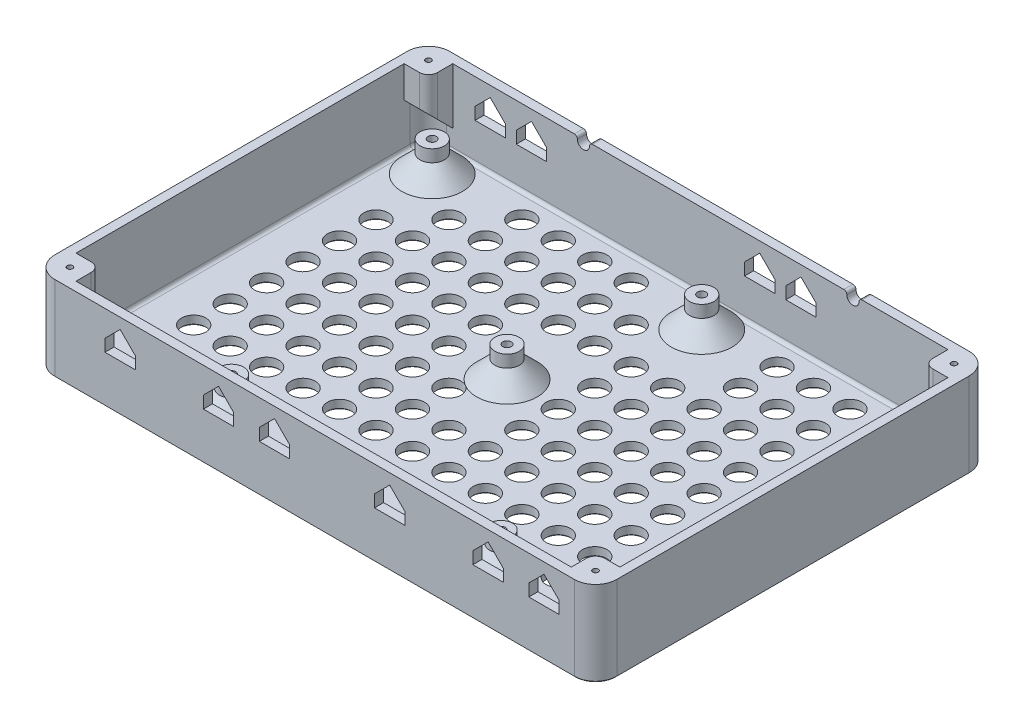
from build123d import *

# Parameters (mm, degrees)
SKETCH_1_W          = 185
SKETCH_1_H          = 130
EXTRUDE_1_DEPTH     = 3
SKETCH_2_R          = 4
SKETCH_2_R_2        = 3.743503122
EXTRUDE_2_DEPTH     = 10
CHAMFER_1_SIZE      = 6
SKETCH_3_R          = 1.4
CUT_EXTRUDE_1_DEPTH = 227.481787347
SKETCH_4_W          = 185
SKETCH_4_H          = 130
SKETCH_4_W_2        = 179
SKETCH_4_H_2        = 124
EXTRUDE_3_DEPTH     = 25
SKETCH_5_R          = 2
SKETCH_5_W          = 9.999999909
SKETCH_5_H          = 8.999999917
SKETCH_5_W_2        = 9.999999908
CUT_EXTRUDE_2_DEPTH = 5
SKETCH_6_W          = 9.999999909
SKETCH_6_H          = 8.999999917
SKETCH_6_W_2        = 9.999999908
CUT_EXTRUDE_3_DEPTH = 5
SKETCH_8_R          = 4
CUT_EXTRUDE_5_DEPTH = 228.486263322
OTHER_1_OUTLINE_R   = 4
OTHER_1_DEPTH       = 3
SKETCH_9_W          = 8
SKETCH_9_H          = 8
EXTRUDE_5_DEPTH     = 10
CHAMFER_5_SIZE      = 8.4
CHAMFER_2_SIZE      = 5
FILLET_1_R          = 6
FILLET_2_R          = 1.1
FILLET_3_R          = 7
CHAMFER_4_SIZE      = 0.4
FILLET_4_R          = 3
SKETCH_10_R         = 0.9
CUT_EXTRUDE_6_DEPTH = 10
FILLET_5_R          = 1


with BuildPart() as part:
    # 草图1 → 凸台-拉伸1 (new body)
    with BuildSketch(Plane(origin=(0, 0, 0), x_dir=(1, 0, 0), z_dir=(0, 1, 0))):
        with Locations((92.5, 65)):
            Rectangle(SKETCH_1_W, SKETCH_1_H)
    extrude(amount=EXTRUDE_1_DEPTH)

    # 草图2 → 凸台-拉伸2 (add)
    with BuildSketch(Plane(origin=(0, 3, 0), x_dir=(1, 0, 0), z_dir=(0, 1, 0))):
        with Locations(Location((14.051308103, 117.18090499, 0), (0, 0, 90))):
            Circle(SKETCH_2_R)
        with Locations(Location((102.766065532, 117.18090499, 0), (0, 0, 90))):
            Circle(SKETCH_2_R)
        with Locations(Location((84.917449835, 70.952812534, 0), (0, 0, 90))):
            Circle(SKETCH_2_R)
        with Locations(Location((173.632207264, 70.952812534, 0), (0, 0, 90))):
            Circle(SKETCH_2_R)
        with Locations(Location((136.802133604, 17.104704838, 0), (0, 0, 90))):
            Circle(SKETCH_2_R_2)
        with Locations(Location((48.087376175, 17.104704838, 0), (0, 0, 90))):
            Circle(SKETCH_2_R)
    extrude(amount=EXTRUDE_2_DEPTH)

    # 倒角1
    chamfer_1_edges = [part.edges().sort_by_distance(p)[0] for p in [
        (14.051308103, 3, -113.18090499),
        (102.766065532, 3, -113.18090499),
        (84.917449835, 3, -66.952812534),
        (173.632207264, 3, -66.952812534),
        (136.802133604, 3, -13.361201716),
        (48.087376175, 3, -13.104704838),
    ]]
    chamfer(chamfer_1_edges, length=CHAMFER_1_SIZE)

    # 草图3 → 切除-拉伸1 (cut, through all)
    with BuildSketch(Plane(origin=(0, 13, 0), x_dir=(1, 0, 0), z_dir=(0, 1, 0))):
        with Locations(Location((14.051308103, 117.18090499, 0), (0, 0, 270))):
            Circle(SKETCH_3_R)
        with Locations(Location((102.766065532, 117.18090499, 0), (0, 0, 270))):
            Circle(SKETCH_3_R)
        with Locations(Location((84.917449835, 70.952812534, 0), (0, 0, 270))):
            Circle(SKETCH_3_R)
        with Locations(Location((173.632207264, 70.952812534, 0), (0, 0, 270))):
            Circle(SKETCH_3_R)
        with Locations(Location((136.802133604, 17.104704838, 0), (0, 0, 270))):
            Circle(SKETCH_3_R)
        with Locations(Location((48.087376175, 17.104704838, 0), (0, 0, 270))):
            Circle(SKETCH_3_R)
    extrude(amount=-CUT_EXTRUDE_1_DEPTH, mode=Mode.SUBTRACT)

    # 草图4 → 凸台-拉伸3 (add)
    with BuildSketch(Plane(origin=(0, 3, 0), x_dir=(1, 0, 0), z_dir=(0, 1, 0))):
        with Locations((92.5, 65)):
            Rectangle(SKETCH_4_W, SKETCH_4_H)
        with Locations((92.5, 65)):
            Rectangle(SKETCH_4_W_2, SKETCH_4_H_2, mode=Mode.SUBTRACT)
    extrude(amount=EXTRUDE_3_DEPTH)

    # 草图5 → 切除-拉伸2 (cut)
    with BuildSketch(Plane.XY.offset(-127)):
        with Locations((54.012081638, 27)):
            Circle(SKETCH_5_R)
        with Locations((142.725850156, 27)):
            Circle(SKETCH_5_R)
        with Locations((23.32232669, 20.000050521)):
            Rectangle(SKETCH_5_W, SKETCH_5_H)
        with Locations((36.911353869, 20.000050521)):
            Rectangle(SKETCH_5_W, SKETCH_5_H)
        with Locations((112.03708412, 20.000050521)):
            Rectangle(SKETCH_5_W_2, SKETCH_5_H)
        with Locations((125.626111298, 20.000050521)):
            Rectangle(SKETCH_5_W_2, SKETCH_5_H)
    extrude(amount=-CUT_EXTRUDE_2_DEPTH, mode=Mode.SUBTRACT)

    # 草图6 → 切除-拉伸3 (cut)
    with BuildSketch(Plane(origin=(0, 0, -3), x_dir=(-1, 0, 0), z_dir=(0, 0, -1))):
        with Locations((-168.044196043, 20.000050521)):
            Rectangle(SKETCH_6_W, SKETCH_6_H)
        with Locations((-149.629159213, 20.000050521)):
            Rectangle(SKETCH_6_W, SKETCH_6_H)
        with Locations((-117.244094442, 20.000050521)):
            Rectangle(SKETCH_6_W_2, SKETCH_6_H)
        with Locations((-79.329438613, 20.000050521)):
            Rectangle(SKETCH_6_W_2, SKETCH_6_H)
        with Locations((-60.914401783, 20.000050521)):
            Rectangle(SKETCH_6_W_2, SKETCH_6_H)
        with Locations((-28.529337013, 20.000050521)):
            Rectangle(SKETCH_6_W_2, SKETCH_6_H)
    extrude(amount=-CUT_EXTRUDE_3_DEPTH, mode=Mode.SUBTRACT)

    # 草图8 → 切除-拉伸5 (cut, through all)
    with BuildSketch(Plane(origin=(0, 3, 0), x_dir=(1, 0, 0), z_dir=(0, 1, 0))):
        with Locations(Location((41.857690787, 82.878788219, 0), (0, 0, 270))):
            Circle(SKETCH_8_R)
    extrude(amount=-CUT_EXTRUDE_5_DEPTH, mode=Mode.SUBTRACT)

    # 填充阵列1: read off the stored shape, not the designer's step
    # 填充阵列1 outline → 填充阵列1 (cut)
    with BuildSketch(Plane(origin=(0, 0, 0), x_dir=(1, 0, 0), z_dir=(0, 1, 0))):
        with Locations((77.857690787, 58.878788219)):
            Circle(OTHER_1_OUTLINE_R)
        with Locations((17.857690787, 10.878788219)):
            Circle(OTHER_1_OUTLINE_R)
        with Locations((29.857690787, 94.878788219)):
            Circle(OTHER_1_OUTLINE_R)
        with Locations((41.857690787, 94.878788219)):
            Circle(OTHER_1_OUTLINE_R)
        with Locations((53.857690787, 94.878788219)):
            Circle(OTHER_1_OUTLINE_R)
        with Locations((65.857690787, 94.878788219)):
            Circle(OTHER_1_OUTLINE_R)
        with Locations((77.857690787, 94.878788219)):
            Circle(OTHER_1_OUTLINE_R)
        with Locations((89.857690787, 94.878788219)):
            Circle(OTHER_1_OUTLINE_R)
        with Locations((101.857690787, 94.878788219)):
            Circle(OTHER_1_OUTLINE_R)
        with Locations((113.857690787, 94.878788219)):
            Circle(OTHER_1_OUTLINE_R)
        with Locations((173.857690787, 94.878788219)):
            Circle(OTHER_1_OUTLINE_R)
        with Locations((29.857690787, 106.878788219)):
            Circle(OTHER_1_OUTLINE_R)
        with Locations((41.857690787, 106.878788219)):
            Circle(OTHER_1_OUTLINE_R)
        with Locations((53.857690787, 106.878788219)):
            Circle(OTHER_1_OUTLINE_R)
        with Locations((161.857690787, 94.878788219)):
            Circle(OTHER_1_OUTLINE_R)
        with Locations((149.857690787, 94.878788219)):
            Circle(OTHER_1_OUTLINE_R)
        with Locations((137.857690787, 94.878788219)):
            Circle(OTHER_1_OUTLINE_R)
        with Locations((125.857690787, 94.878788219)):
            Circle(OTHER_1_OUTLINE_R)
        with Locations((149.857690787, 70.878788219)):
            Circle(OTHER_1_OUTLINE_R)
        with Locations((17.857690787, 82.878788219)):
            Circle(OTHER_1_OUTLINE_R)
        with Locations((29.857690787, 82.878788219)):
            Circle(OTHER_1_OUTLINE_R)
        with Locations((53.857690787, 82.878788219)):
            Circle(OTHER_1_OUTLINE_R)
        with Locations((137.857690787, 70.878788219)):
            Circle(OTHER_1_OUTLINE_R)
        with Locations((125.857690787, 70.878788219)):
            Circle(OTHER_1_OUTLINE_R)
        with Locations((113.857690787, 70.878788219)):
            Circle(OTHER_1_OUTLINE_R)
        with Locations((101.857690787, 70.878788219)):
            Circle(OTHER_1_OUTLINE_R)
        with Locations((137.857690787, 82.878788219)):
            Circle(OTHER_1_OUTLINE_R)
        with Locations((149.857690787, 82.878788219)):
            Circle(OTHER_1_OUTLINE_R)
        with Locations((161.857690787, 82.878788219)):
            Circle(OTHER_1_OUTLINE_R)
        with Locations((17.857690787, 94.878788219)):
            Circle(OTHER_1_OUTLINE_R)
        with Locations((125.857690787, 82.878788219)):
            Circle(OTHER_1_OUTLINE_R)
        with Locations((113.857690787, 82.878788219)):
            Circle(OTHER_1_OUTLINE_R)
        with Locations((101.857690787, 82.878788219)):
            Circle(OTHER_1_OUTLINE_R)
        with Locations((65.857690787, 82.878788219)):
            Circle(OTHER_1_OUTLINE_R)
        with Locations((173.857690787, 118.878788219)):
            Circle(OTHER_1_OUTLINE_R)
        with Locations((161.857690787, 118.878788219)):
            Circle(OTHER_1_OUTLINE_R)
        with Locations((149.857690787, 118.878788219)):
            Circle(OTHER_1_OUTLINE_R)
        with Locations((137.857690787, 118.878788219)):
            Circle(OTHER_1_OUTLINE_R)
        with Locations((125.857690787, 118.878788219)):
            Circle(OTHER_1_OUTLINE_R)
        with Locations((77.857690787, 118.878788219)):
            Circle(OTHER_1_OUTLINE_R)
        with Locations((65.857690787, 118.878788219)):
            Circle(OTHER_1_OUTLINE_R)
        with Locations((53.857690787, 118.878788219)):
            Circle(OTHER_1_OUTLINE_R)
        with Locations((41.857690787, 118.878788219)):
            Circle(OTHER_1_OUTLINE_R)
        with Locations((173.857690787, 106.878788219)):
            Circle(OTHER_1_OUTLINE_R)
        with Locations((161.857690787, 106.878788219)):
            Circle(OTHER_1_OUTLINE_R)
        with Locations((149.857690787, 106.878788219)):
            Circle(OTHER_1_OUTLINE_R)
        with Locations((137.857690787, 106.878788219)):
            Circle(OTHER_1_OUTLINE_R)
        with Locations((125.857690787, 106.878788219)):
            Circle(OTHER_1_OUTLINE_R)
        with Locations((89.857690787, 106.878788219)):
            Circle(OTHER_1_OUTLINE_R)
        with Locations((77.857690787, 106.878788219)):
            Circle(OTHER_1_OUTLINE_R)
        with Locations((65.857690787, 106.878788219)):
            Circle(OTHER_1_OUTLINE_R)
        with Locations((65.857690787, 34.878788219)):
            Circle(OTHER_1_OUTLINE_R)
        with Locations((53.857690787, 34.878788219)):
            Circle(OTHER_1_OUTLINE_R)
        with Locations((41.857690787, 34.878788219)):
            Circle(OTHER_1_OUTLINE_R)
        with Locations((29.857690787, 34.878788219)):
            Circle(OTHER_1_OUTLINE_R)
        with Locations((149.857690787, 22.878788219)):
            Circle(OTHER_1_OUTLINE_R)
        with Locations((161.857690787, 22.878788219)):
            Circle(OTHER_1_OUTLINE_R)
        with Locations((173.857690787, 22.878788219)):
            Circle(OTHER_1_OUTLINE_R)
        with Locations((17.857690787, 34.878788219)):
            Circle(OTHER_1_OUTLINE_R)
        with Locations((77.857690787, 34.878788219)):
            Circle(OTHER_1_OUTLINE_R)
        with Locations((89.857690787, 34.878788219)):
            Circle(OTHER_1_OUTLINE_R)
        with Locations((101.857690787, 34.878788219)):
            Circle(OTHER_1_OUTLINE_R)
        with Locations((113.857690787, 34.878788219)):
            Circle(OTHER_1_OUTLINE_R)
        with Locations((125.857690787, 34.878788219)):
            Circle(OTHER_1_OUTLINE_R)
        with Locations((137.857690787, 34.878788219)):
            Circle(OTHER_1_OUTLINE_R)
        with Locations((149.857690787, 34.878788219)):
            Circle(OTHER_1_OUTLINE_R)
        with Locations((161.857690787, 34.878788219)):
            Circle(OTHER_1_OUTLINE_R)
        with Locations((29.857690787, 10.878788219)):
            Circle(OTHER_1_OUTLINE_R)
        with Locations((65.857690787, 10.878788219)):
            Circle(OTHER_1_OUTLINE_R)
        with Locations((77.857690787, 10.878788219)):
            Circle(OTHER_1_OUTLINE_R)
        with Locations((89.857690787, 10.878788219)):
            Circle(OTHER_1_OUTLINE_R)
        with Locations((101.857690787, 10.878788219)):
            Circle(OTHER_1_OUTLINE_R)
        with Locations((113.857690787, 10.878788219)):
            Circle(OTHER_1_OUTLINE_R)
        with Locations((149.857690787, 10.878788219)):
            Circle(OTHER_1_OUTLINE_R)
        with Locations((161.857690787, 10.878788219)):
            Circle(OTHER_1_OUTLINE_R)
        with Locations((113.857690787, 22.878788219)):
            Circle(OTHER_1_OUTLINE_R)
        with Locations((101.857690787, 22.878788219)):
            Circle(OTHER_1_OUTLINE_R)
        with Locations((89.857690787, 22.878788219)):
            Circle(OTHER_1_OUTLINE_R)
        with Locations((77.857690787, 22.878788219)):
            Circle(OTHER_1_OUTLINE_R)
        with Locations((173.857690787, 10.878788219)):
            Circle(OTHER_1_OUTLINE_R)
        with Locations((17.857690787, 22.878788219)):
            Circle(OTHER_1_OUTLINE_R)
        with Locations((29.857690787, 22.878788219)):
            Circle(OTHER_1_OUTLINE_R)
        with Locations((65.857690787, 22.878788219)):
            Circle(OTHER_1_OUTLINE_R)
        with Locations((29.857690787, 58.878788219)):
            Circle(OTHER_1_OUTLINE_R)
        with Locations((41.857690787, 58.878788219)):
            Circle(OTHER_1_OUTLINE_R)
        with Locations((53.857690787, 58.878788219)):
            Circle(OTHER_1_OUTLINE_R)
        with Locations((65.857690787, 58.878788219)):
            Circle(OTHER_1_OUTLINE_R)
        with Locations((101.857690787, 58.878788219)):
            Circle(OTHER_1_OUTLINE_R)
        with Locations((113.857690787, 58.878788219)):
            Circle(OTHER_1_OUTLINE_R)
        with Locations((125.857690787, 58.878788219)):
            Circle(OTHER_1_OUTLINE_R)
        with Locations((65.857690787, 70.878788219)):
            Circle(OTHER_1_OUTLINE_R)
        with Locations((53.857690787, 70.878788219)):
            Circle(OTHER_1_OUTLINE_R)
        with Locations((41.857690787, 70.878788219)):
            Circle(OTHER_1_OUTLINE_R)
        with Locations((29.857690787, 70.878788219)):
            Circle(OTHER_1_OUTLINE_R)
        with Locations((137.857690787, 58.878788219)):
            Circle(OTHER_1_OUTLINE_R)
        with Locations((149.857690787, 58.878788219)):
            Circle(OTHER_1_OUTLINE_R)
        with Locations((161.857690787, 58.878788219)):
            Circle(OTHER_1_OUTLINE_R)
        with Locations((17.857690787, 70.878788219)):
            Circle(OTHER_1_OUTLINE_R)
        with Locations((89.857690787, 46.878788219)):
            Circle(OTHER_1_OUTLINE_R)
        with Locations((77.857690787, 46.878788219)):
            Circle(OTHER_1_OUTLINE_R)
        with Locations((65.857690787, 46.878788219)):
            Circle(OTHER_1_OUTLINE_R)
        with Locations((53.857690787, 46.878788219)):
            Circle(OTHER_1_OUTLINE_R)
        with Locations((173.857690787, 34.878788219)):
            Circle(OTHER_1_OUTLINE_R)
        with Locations((17.857690787, 46.878788219)):
            Circle(OTHER_1_OUTLINE_R)
        with Locations((29.857690787, 46.878788219)):
            Circle(OTHER_1_OUTLINE_R)
        with Locations((41.857690787, 46.878788219)):
            Circle(OTHER_1_OUTLINE_R)
        with Locations((149.857690787, 46.878788219)):
            Circle(OTHER_1_OUTLINE_R)
        with Locations((161.857690787, 46.878788219)):
            Circle(OTHER_1_OUTLINE_R)
        with Locations((173.857690787, 46.878788219)):
            Circle(OTHER_1_OUTLINE_R)
        with Locations((17.857690787, 58.878788219)):
            Circle(OTHER_1_OUTLINE_R)
        with Locations((137.857690787, 46.878788219)):
            Circle(OTHER_1_OUTLINE_R)
        with Locations((125.857690787, 46.878788219)):
            Circle(OTHER_1_OUTLINE_R)
        with Locations((113.857690787, 46.878788219)):
            Circle(OTHER_1_OUTLINE_R)
        with Locations((101.857690787, 46.878788219)):
            Circle(OTHER_1_OUTLINE_R)
    extrude(amount=OTHER_1_DEPTH, mode=Mode.SUBTRACT)

    # 草图9 → 凸台-拉伸5 (add)
    with BuildSketch(Plane(origin=(0, 28, 0), x_dir=(1, 0, 0), z_dir=(0, 1, 0))):
        with Locations((7, 123)):
            Rectangle(SKETCH_9_W, SKETCH_9_H)
        with Locations((7, 7)):
            Rectangle(SKETCH_9_W, SKETCH_9_H)
        with Locations((178, 123)):
            Rectangle(SKETCH_9_W, SKETCH_9_H)
        with Locations((178, 7)):
            Rectangle(SKETCH_9_W, SKETCH_9_H)
    extrude(amount=-EXTRUDE_5_DEPTH)

    # 倒角5
    # the kernel refuses this chamfer: 8.4 mm, written as the material it adds along each edge
    with BuildSketch(Plane(origin=(3, 18, -3), x_dir=(0, -1, 0), z_dir=(1, 0, 0))) as chamfer_5_piece_1_section:
        Polygon((CHAMFER_5_SIZE, 0), (0, CHAMFER_5_SIZE), (0, 0), align=None)
    chamfer_5_piece_1 = extrude(amount=8, mode=Mode.PRIVATE)
    chamfer_5_piece_1 = split(chamfer_5_piece_1, bisect_by=Plane(origin=(3, 18, -11), z_dir=(0, 0, 1)), keep=Keep.TOP, mode=Mode.PRIVATE)
    add(chamfer_5_piece_1)
    with BuildSketch(Plane(origin=(182, 18, -3), x_dir=(0, -1, 0), z_dir=(-1, 0, 0))) as chamfer_5_piece_2_section:
        Polygon((CHAMFER_5_SIZE, 0), (0, -CHAMFER_5_SIZE), (0, 0), align=None)
    chamfer_5_piece_2 = extrude(amount=8, mode=Mode.PRIVATE)
    chamfer_5_piece_2 = split(chamfer_5_piece_2, bisect_by=Plane(origin=(182, 18, -11), z_dir=(0, 0, 1)), keep=Keep.TOP, mode=Mode.PRIVATE)
    add(chamfer_5_piece_2)
    with BuildSketch(Plane(origin=(3, 18, -127), x_dir=(0, -1, 0), z_dir=(1, 0, 0))) as chamfer_5_piece_3_section:
        Polygon((CHAMFER_5_SIZE, 0), (0, -CHAMFER_5_SIZE), (0, 0), align=None)
    chamfer_5_piece_3 = extrude(amount=8, mode=Mode.PRIVATE)
    chamfer_5_piece_3 = split(chamfer_5_piece_3, bisect_by=Plane(origin=(3, 18, -119), z_dir=(0, 0, -1)), keep=Keep.TOP, mode=Mode.PRIVATE)
    add(chamfer_5_piece_3)
    with BuildSketch(Plane(origin=(182, 18, -127), x_dir=(0, -1, 0), z_dir=(-1, 0, 0))) as chamfer_5_piece_4_section:
        Polygon((CHAMFER_5_SIZE, 0), (0, CHAMFER_5_SIZE), (0, 0), align=None)
    chamfer_5_piece_4 = extrude(amount=8, mode=Mode.PRIVATE)
    chamfer_5_piece_4 = split(chamfer_5_piece_4, bisect_by=Plane(origin=(182, 18, -119), z_dir=(0, 0, -1)), keep=Keep.TOP, mode=Mode.PRIVATE)
    add(chamfer_5_piece_4)

    # 倒角2
    chamfer_2_edges = [part.edges().sort_by_distance(p)[0] for p in [
        (107.037084166, 24.500050479, -128.5),
        (120.626111344, 24.500050479, -128.5),
        (31.911353914, 24.500050479, -128.5),
        (18.322326736, 24.500050479, -128.5),
        (117.037084074, 24.500050479, -128.5),
        (130.626111252, 24.500050479, -128.5),
        (28.322326645, 24.500050479, -128.5),
        (41.911353823, 24.500050479, -128.5),
        (122.244094396, 24.500050479, -1.5),
        (154.629159167, 24.500050479, -1.5),
        (173.044195997, 24.500050479, -1.5),
        (163.044196088, 24.500050479, -1.5),
        (144.629159258, 24.500050479, -1.5),
        (112.244094488, 24.500050479, -1.5),
        (74.329438659, 24.500050479, -1.5),
        (55.914401829, 24.500050479, -1.5),
        (84.329438567, 24.500050479, -1.5),
        (65.914401737, 24.500050479, -1.5),
        (33.529336967, 24.500050479, -1.5),
        (23.529337059, 24.500050479, -1.5),
    ]]
    chamfer(chamfer_2_edges, length=CHAMFER_2_SIZE - 0.0001)  # a hair under: the kernel refuses the full size

    # 圆角1
    fillet_1_edges = [part.edges().sort_by_distance(p)[0] for p in [
        (182, 6.3, -3),
        (3, 6.3, -3),
        (3, 6.3, -127),
        (182, 6.3, -127),
    ]]
    fillet(fillet_1_edges, radius=FILLET_1_R)

    # 圆角2
    # the kernel refuses this fillet: 1.1 mm, written as the material it adds along each edge
    with BuildSketch(Plane(origin=(3, 3, -121), x_dir=(1, 0, 0), z_dir=(0, 0, 1))) as fillet_2_piece_1:
        with BuildLine():
            CenterArc((FILLET_2_R, FILLET_2_R), FILLET_2_R, 180, 90)
            Line((0, FILLET_2_R), (0, 0))
            Line((0, 0), (FILLET_2_R, 0))
        make_face()
    extrude(amount=112)
    with BuildSketch(Plane(origin=(9, 3, -3), x_dir=(0, 0, -1), z_dir=(1, 0, 0))) as fillet_2_piece_2:
        with BuildLine():
            CenterArc((FILLET_2_R, FILLET_2_R), FILLET_2_R, 180, 90)
            Line((0, FILLET_2_R), (0, 0))
            Line((0, 0), (FILLET_2_R, 0))
        make_face()
    extrude(amount=167)
    with BuildSketch(Plane(origin=(182, 3, -9), x_dir=(-1, 0, 0), z_dir=(0, 0, -1))) as fillet_2_piece_3:
        with BuildLine():
            CenterArc((FILLET_2_R, FILLET_2_R), FILLET_2_R, 180, 90)
            Line((0, FILLET_2_R), (0, 0))
            Line((0, 0), (FILLET_2_R, 0))
        make_face()
    extrude(amount=59.22740892)
    with BuildSketch(Plane(origin=(176, 3, -127), x_dir=(0, 1, 0), z_dir=(-1, 0, 0))) as fillet_2_piece_4:
        with BuildLine():
            CenterArc((FILLET_2_R, -FILLET_2_R), FILLET_2_R, 90, 90)
            Line((0, -FILLET_2_R), (0, 0))
            Line((0, 0), (FILLET_2_R, 0))
        make_face()
    extrude(amount=74.090426297)
    with BuildSketch(Plane(origin=(9, 3, -121), x_dir=(0, 0, -1), z_dir=(1, 0, 0))) as fillet_2_piece_5:
        with BuildLine():
            CenterArc((6 - FILLET_2_R, FILLET_2_R), FILLET_2_R, 270, 90)
            Line((6, FILLET_2_R), (6, 0))
            Line((6, 0), (6 - FILLET_2_R, 0))
        make_face()
    revolve(axis=Axis((9, 3, -121), (0, 1, 0)), revolution_arc=90)
    with BuildSketch(Plane(origin=(176, 3, -121), x_dir=(0, 0, -1), z_dir=(-1, 0, 0))) as fillet_2_piece_6:
        with BuildLine():
            CenterArc((6 - FILLET_2_R, -FILLET_2_R), FILLET_2_R, 0, 90)
            Line((6, -FILLET_2_R), (6, 0))
            Line((6, 0), (6 - FILLET_2_R, 0))
        make_face()
    revolve(axis=Axis((176, 3, -121), (0, -1, 0)), revolution_arc=90)
    with BuildSketch(Plane(origin=(176, 3, -9), x_dir=(1, 0, 0), z_dir=(0, 0, -1))) as fillet_2_piece_7:
        with BuildLine():
            CenterArc((6 - FILLET_2_R, -FILLET_2_R), FILLET_2_R, 0, 90)
            Line((6, -FILLET_2_R), (6, 0))
            Line((6, 0), (6 - FILLET_2_R, 0))
        make_face()
    revolve(axis=Axis((176, 3, -9), (0, -1, 0)), revolution_arc=90)
    with BuildSketch(Plane(origin=(9, 3, -9), x_dir=(-1, 0, 0), z_dir=(0, 0, -1))) as fillet_2_piece_8:
        with BuildLine():
            CenterArc((6 - FILLET_2_R, FILLET_2_R), FILLET_2_R, 270, 90)
            Line((6, FILLET_2_R), (6, 0))
            Line((6, 0), (6 - FILLET_2_R, 0))
        make_face()
    revolve(axis=Axis((9, 3, -9), (0, 1, 0)), revolution_arc=90)
    with BuildSketch(Plane(origin=(182, 3, -73.678216148), x_dir=(-1, 0, 0), z_dir=(0, 0, -1))) as fillet_2_piece_9:
        with BuildLine():
            CenterArc((FILLET_2_R, FILLET_2_R), FILLET_2_R, 180, 90)
            Line((0, FILLET_2_R), (0, 0))
            Line((0, 0), (FILLET_2_R, 0))
        make_face()
    extrude(amount=47.321783852)
    with BuildSketch(Plane(origin=(103.622557362, 3, -127), x_dir=(0, 1, 0), z_dir=(-1, 0, 0))) as fillet_2_piece_10:
        with BuildLine():
            CenterArc((FILLET_2_R, -FILLET_2_R), FILLET_2_R, 90, 90)
            Line((0, -FILLET_2_R), (0, 0))
            Line((0, 0), (FILLET_2_R, 0))
        make_face()
    extrude(amount=90.427741089)
    with BuildSketch(Plane(origin=(14.907799932, 3, -127), x_dir=(0, 1, 0), z_dir=(-1, 0, 0))) as fillet_2_piece_11:
        with BuildLine():
            CenterArc((FILLET_2_R, -FILLET_2_R), FILLET_2_R, 90, 90)
            Line((0, -FILLET_2_R), (0, 0))
            Line((0, 0), (FILLET_2_R, 0))
        make_face()
    extrude(amount=5.907799932)

    # 圆角3
    fillet_3_edges = [part.edges().sort_by_distance(p)[0] for p in [
        (0, 14, -130),
        (185, 14, -130),
        (185, 14, 0),
        (0, 14, 0),
    ]]
    fillet(fillet_3_edges, radius=FILLET_3_R)

    # 倒角4
    chamfer_4_edges = [part.edges().sort_by_distance(p)[0] for p in [
        (92.5, 0, -130),
        (0, 0, -65),
        (185, 0, -65),
        (92.5, 0, 0),
        (2.050252532, 0, -127.949747468),
        (2.050252532, 0, -2.050252532),
        (182.949747468, 0, -2.050252532),
        (182.949747468, 0, -127.949747468),
        (41.857690787, 0, -86.878788219),
        (97.857690787, 0, -46.878788219),
        (109.857690787, 0, -46.878788219),
        (121.857690787, 0, -46.878788219),
        (133.857690787, 0, -46.878788219),
        (13.857690787, 0, -58.878788219),
        (169.857690787, 0, -46.878788219),
        (157.857690787, 0, -46.878788219),
        (145.857690787, 0, -46.878788219),
        (37.857690787, 0, -46.878788219),
        (25.857690787, 0, -46.878788219),
        (13.857690787, 0, -46.878788219),
        (169.857690787, 0, -34.878788219),
        (49.857690787, 0, -46.878788219),
        (61.857690787, 0, -46.878788219),
        (73.857690787, 0, -46.878788219),
        (85.857690787, 0, -46.878788219),
        (13.857690787, 0, -70.878788219),
        (157.857690787, 0, -58.878788219),
        (145.857690787, 0, -58.878788219),
        (133.857690787, 0, -58.878788219),
        (25.857690787, 0, -70.878788219),
        (37.857690787, 0, -70.878788219),
        (49.857690787, 0, -70.878788219),
        (61.857690787, 0, -70.878788219),
        (121.857690787, 0, -58.878788219),
        (109.857690787, 0, -58.878788219),
        (97.857690787, 0, -58.878788219),
        (73.857690787, 0, -58.878788219),
        (61.857690787, 0, -58.878788219),
        (49.857690787, 0, -58.878788219),
        (37.857690787, 0, -58.878788219),
        (25.857690787, 0, -58.878788219),
        (61.857690787, 0, -22.878788219),
        (25.857690787, 0, -22.878788219),
        (13.857690787, 0, -22.878788219),
        (169.857690787, 0, -10.878788219),
        (73.857690787, 0, -22.878788219),
        (85.857690787, 0, -22.878788219),
        (97.857690787, 0, -22.878788219),
        (109.857690787, 0, -22.878788219),
        (157.857690787, 0, -10.878788219),
        (145.857690787, 0, -10.878788219),
        (109.857690787, 0, -10.878788219),
        (97.857690787, 0, -10.878788219),
        (85.857690787, 0, -10.878788219),
        (73.857690787, 0, -10.878788219),
        (61.857690787, 0, -10.878788219),
        (25.857690787, 0, -10.878788219),
        (157.857690787, 0, -34.878788219),
        (145.857690787, 0, -34.878788219),
        (133.857690787, 0, -34.878788219),
        (121.857690787, 0, -34.878788219),
        (109.857690787, 0, -34.878788219),
        (97.857690787, 0, -34.878788219),
        (85.857690787, 0, -34.878788219),
        (73.857690787, 0, -34.878788219),
        (13.857690787, 0, -34.878788219),
        (169.857690787, 0, -22.878788219),
        (157.857690787, 0, -22.878788219),
        (145.857690787, 0, -22.878788219),
        (25.857690787, 0, -34.878788219),
        (37.857690787, 0, -34.878788219),
        (49.857690787, 0, -34.878788219),
        (61.857690787, 0, -34.878788219),
        (61.857690787, 0, -106.878788219),
        (73.857690787, 0, -106.878788219),
        (85.857690787, 0, -106.878788219),
        (121.857690787, 0, -106.878788219),
        (133.857690787, 0, -106.878788219),
        (145.857690787, 0, -106.878788219),
        (14.051308103, 0, -118.58090499),
        (157.857690787, 0, -106.878788219),
        (169.857690787, 0, -106.878788219),
        (37.857690787, 0, -118.878788219),
        (49.857690787, 0, -118.878788219),
        (61.857690787, 0, -118.878788219),
        (73.857690787, 0, -118.878788219),
        (121.857690787, 0, -118.878788219),
        (133.857690787, 0, -118.878788219),
        (102.766065532, 0, -118.58090499),
        (145.857690787, 0, -118.878788219),
        (157.857690787, 0, -118.878788219),
        (169.857690787, 0, -118.878788219),
        (61.857690787, 0, -82.878788219),
        (97.857690787, 0, -82.878788219),
        (109.857690787, 0, -82.878788219),
        (121.857690787, 0, -82.878788219),
        (84.917449835, 0, -72.352812534),
        (13.857690787, 0, -94.878788219),
        (157.857690787, 0, -82.878788219),
        (145.857690787, 0, -82.878788219),
        (133.857690787, 0, -82.878788219),
        (97.857690787, 0, -70.878788219),
        (109.857690787, 0, -70.878788219),
        (121.857690787, 0, -70.878788219),
        (133.857690787, 0, -70.878788219),
        (173.632207264, 0, -72.352812534),
        (49.857690787, 0, -82.878788219),
        (25.857690787, 0, -82.878788219),
        (13.857690787, 0, -82.878788219),
        (145.857690787, 0, -70.878788219),
        (121.857690787, 0, -94.878788219),
        (133.857690787, 0, -94.878788219),
        (145.857690787, 0, -94.878788219),
        (136.802133604, 0, -18.504704838),
        (157.857690787, 0, -94.878788219),
        (49.857690787, 0, -106.878788219),
        (37.857690787, 0, -106.878788219),
        (25.857690787, 0, -106.878788219),
        (169.857690787, 0, -94.878788219),
        (109.857690787, 0, -94.878788219),
        (97.857690787, 0, -94.878788219),
        (85.857690787, 0, -94.878788219),
        (48.087376175, 0, -18.504704838),
        (73.857690787, 0, -94.878788219),
        (61.857690787, 0, -94.878788219),
        (49.857690787, 0, -94.878788219),
        (37.857690787, 0, -94.878788219),
        (25.857690787, 0, -94.878788219),
        (13.857690787, 0, -10.878788219),
    ]]
    chamfer(chamfer_4_edges, length=CHAMFER_4_SIZE)

    # 圆角4
    fillet_4_edges = [part.edges().sort_by_distance(p)[0] for p in [
        (11, 22.8, -119),
        (11, 22.8, -11),
        (174, 22.8, -119),
        (174, 22.8, -11),
    ]]
    fillet(fillet_4_edges, radius=FILLET_4_R)

    # 草图10 → 切除-拉伸6 (cut)
    with BuildSketch(Plane(origin=(0, 28, 0), x_dir=(1, 0, 0), z_dir=(0, 1, 0))):
        with Locations(Location((6, 124, 0), (0, 0, 270))):
            Circle(SKETCH_10_R)
        with Locations(Location((179, 124, 0), (0, 0, 270))):
            Circle(SKETCH_10_R)
        with Locations(Location((179, 6, 0), (0, 0, 270))):
            Circle(SKETCH_10_R)
        with Locations(Location((6, 6, 0), (0, 0, 270))):
            Circle(SKETCH_10_R)
    extrude(amount=-CUT_EXTRUDE_6_DEPTH, mode=Mode.SUBTRACT)

    # 圆角5
    fillet_5_edges = [part.edges().sort_by_distance(p)[0] for p in [
        (144.457900964, 28, -128.5),
        (140.993799349, 28, -128.5),
        (55.744132445, 28, -128.5),
        (52.28003083, 28, -128.5),
    ]]
    fillet(fillet_5_edges, radius=FILLET_5_R)


solid = part.part
